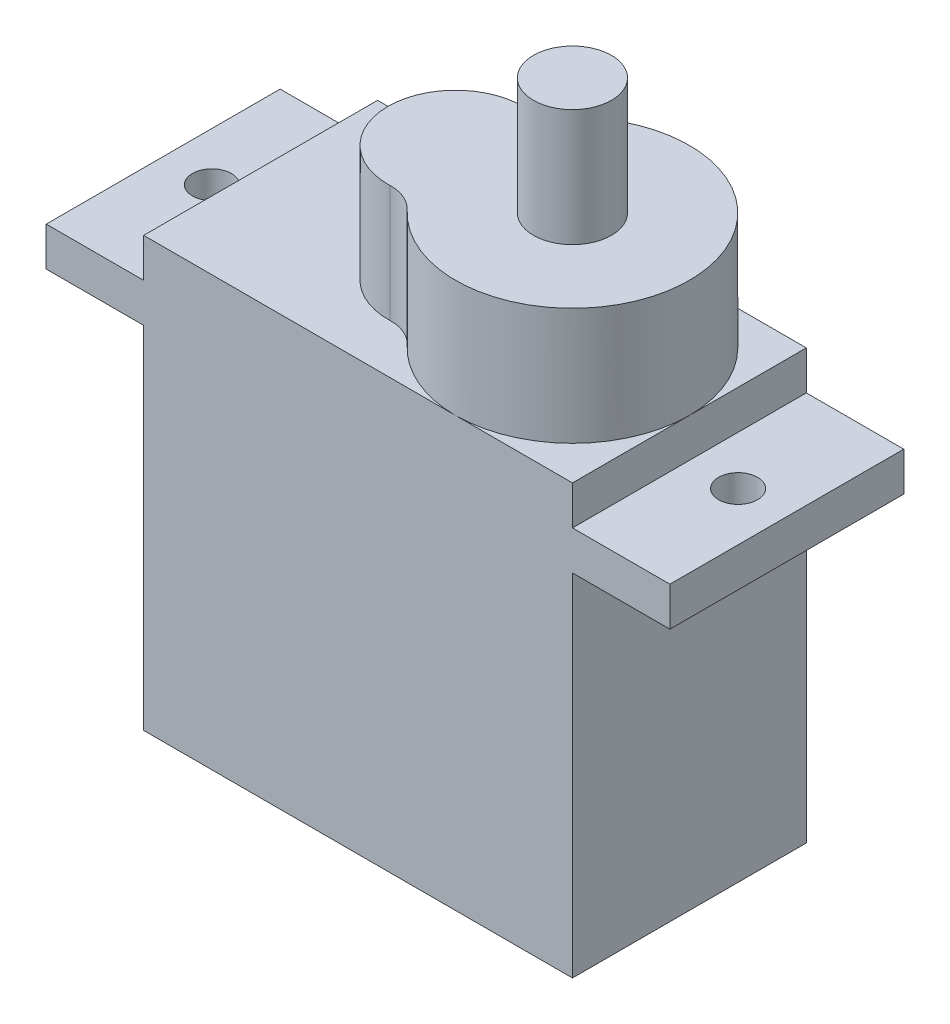
from build123d import *

# Parameters (mm, degrees)
SKETCH_1_W          = 22
SKETCH_1_H          = 12
EXTRUDE_1_DEPTH     = 22
SKETCH_2_W          = 5
SKETCH_2_H          = 12
EXTRUDE_2_DEPTH     = 2
SKETCH_3_R          = 1
CUT_EXTRUDE_1_DEPTH = 2
EXTRUDE_3_DEPTH     = 6
SKETCH_5_R          = 2
EXTRUDE_4_DEPTH     = 6


with BuildPart() as part:
    # 草图1 → 凸台-拉伸1 (new body)
    with BuildSketch(Plane(origin=(0, 0, 0), x_dir=(1, 0, 0), z_dir=(0, 1, 0))):
        Rectangle(SKETCH_1_W, SKETCH_1_H)
    extrude(amount=EXTRUDE_1_DEPTH)

    # 草图2 → 凸台-拉伸2 (add)
    with BuildSketch(Plane(origin=(0, 20, 0), x_dir=(1, 0, 0), z_dir=(0, 1, 0))):
        with Locations((-13.5, 0)):
            Rectangle(SKETCH_2_W, SKETCH_2_H)
        with Locations((13.5, 0)):
            Rectangle(SKETCH_2_W, SKETCH_2_H)
    extrude(amount=-EXTRUDE_2_DEPTH)

    # 草图3 → 切除-拉伸1 (cut)
    with BuildSketch(Plane(origin=(0, 20, 0), x_dir=(1, 0, 0), z_dir=(0, 1, 0))):
        with Locations((-13.5, 0)):
            Circle(SKETCH_3_R)
        with Locations((13.5, 0)):
            Circle(SKETCH_3_R)
    extrude(amount=-CUT_EXTRUDE_1_DEPTH, mode=Mode.SUBTRACT)

    # 草图4 → 凸台-拉伸3 (add)
    with BuildSketch(Plane(origin=(0, 22, 0), x_dir=(1, 0, 0), z_dir=(0, 1, 0))):
        with BuildLine():
            ThreePointArc((0.616655482, -4.097107618), (11, 0), (0.616655482, 4.097107618))
            ThreePointArc((0.616655482, 4.097107618), (-0.074221889, 3.617076091), (-0.901381575, 3.463620356))
            ThreePointArc((-0.901381575, 3.463620356), (-4.465024035, 0), (-0.901381575, -3.463620356))
            ThreePointArc((-0.901381575, -3.463620356), (-0.074221889, -3.617076091), (0.616655482, -4.097107618))
        make_face()
    extrude(amount=EXTRUDE_3_DEPTH)

    # 草图5 → 凸台-拉伸4 (add)
    with BuildSketch(Plane(origin=(0, 28, 0), x_dir=(1, 0, 0), z_dir=(0, 1, 0))):
        with Locations((5, 0)):
            Circle(SKETCH_5_R)
    extrude(amount=EXTRUDE_4_DEPTH)


solid = part.part
